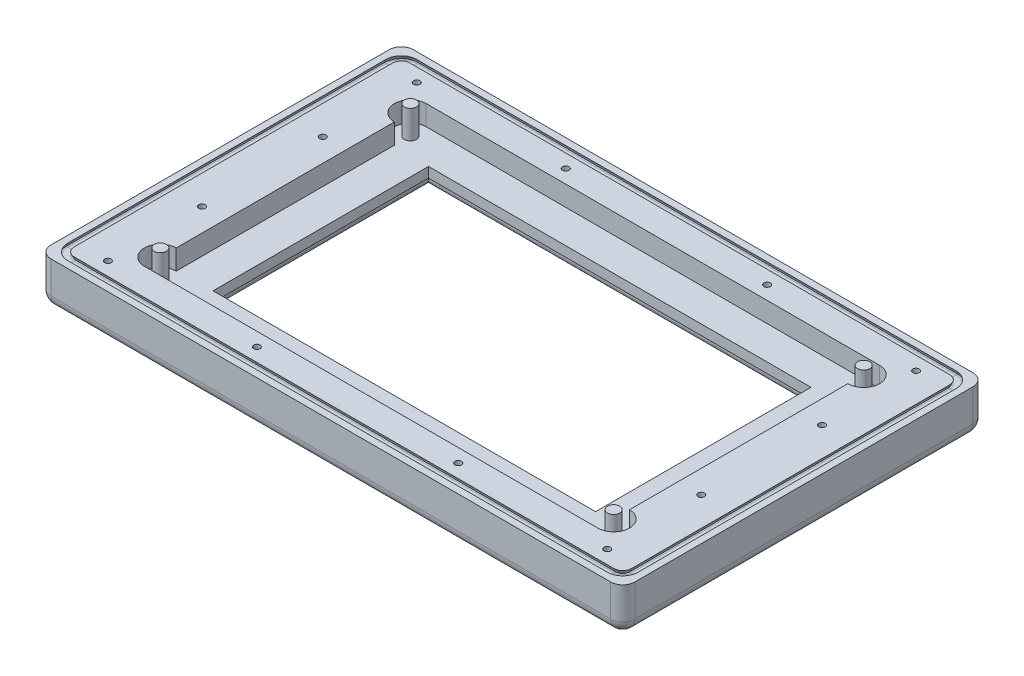
from build123d import *

# Parameters (mm, degrees)
SKETCH1_W                      = 145
SKETCH1_H                      = 90
BOSS_EXTRUDE1_DEPTH            = 6
SKETCH3_W                      = 145
SKETCH3_H                      = 90
SKETCH3_W_2                    = 135
SKETCH3_H_2                    = 80
BOSS_EXTRUDE2_DEPTH            = 5
SKETCH4_W                      = 47.5
SKETCH4_H                      = 26.75
ACRYLIC_CUTOUT_3MM_DEPTH       = 172.014619258
ACRYLIC_LIP_DEPTH              = 3.5
PEGS_DEPTH                     = 7
BOSS_EXTRUDE4_DEPTH            = 5
FILLET1_R                      = 3
FILLET2_R                      = 1
FILLET3_R                      = 3
FILLET4_R                      = 3
FILLET5_R                      = 3
FILLET6_R                      = 3
M2X0_4_TAPPED_HOLE2_AT_2_COUNT = 2
M2X0_4_TAPPED_HOLE2_AT_2_PITCH = 23.35
M2X0_4_TAPPED_HOLE2_AT_3_COUNT = 2
M2X0_4_TAPPED_HOLE2_AT_3_PITCH = 43.751828533


with BuildPart() as part:
    # Sketch1 → Boss-Extrude1 (new body)
    with BuildSketch(Plane(origin=(0, 0, 0), x_dir=(1, 0, 0), z_dir=(0, 1, 0))):
        with Locations((72.5, 45)):
            Rectangle(SKETCH1_W, SKETCH1_H)
    extrude(amount=BOSS_EXTRUDE1_DEPTH)

    # Sketch3 → Boss-Extrude2 (add)
    with BuildSketch(Plane(origin=(0, 6, 0), x_dir=(1, 0, 0), z_dir=(0, 1, 0))):
        with Locations((72.5, 45)):
            Rectangle(SKETCH3_W, SKETCH3_H)
        with Locations((72.5, 45)):
            Rectangle(SKETCH3_W_2, SKETCH3_H_2, mode=Mode.SUBTRACT)
    extrude(amount=BOSS_EXTRUDE2_DEPTH)

    # Sketch4 → Acrylic Cutout_3mm (cut, through all)
    with BuildSketch(Plane.XZ):
        with Locations((48.75, -31.625)):
            Rectangle(SKETCH4_W, SKETCH4_H)
        with Locations((48.75, -58.375)):
            Rectangle(SKETCH4_W, SKETCH4_H)
        with Locations((96.25, -58.375)):
            Rectangle(SKETCH4_W, SKETCH4_H)
        with Locations((96.25, -31.625)):
            Rectangle(SKETCH4_W, SKETCH4_H)
    extrude(amount=-ACRYLIC_CUTOUT_3MM_DEPTH, mode=Mode.SUBTRACT)

    # Sketch4<4> → Acrylic Lip (cut)
    with BuildSketch(Plane.XZ):
        Polygon((72.5, -18.25), (72.5, -16.25), (23, -16.25), (23, -45), (25, -45), (25, -18.25), align=None)
        Polygon((25, -45), (23, -45), (23, -73.75), (72.5, -73.75), (72.5, -71.75), (25, -71.75), align=None)
        Polygon((122, -73.75), (122, -45), (120, -45), (120, -71.75), (72.5, -71.75), (72.5, -73.75), align=None)
        Polygon((122, -16.25), (72.5, -16.25), (72.5, -18.25), (120, -18.25), (120, -45), (122, -45), align=None)
    extrude(amount=-ACRYLIC_LIP_DEPTH, mode=Mode.SUBTRACT)

    # Sketch5 → Pegs (add)
    with BuildSketch(Plane(origin=(0, 6, 0), x_dir=(1, 0, 0), z_dir=(0, 1, 0))):
        with BuildLine():
            ThreePointArc((16.2, 74.55), (17.260660172, 74.989339828), (17.7, 76.05))
            Line((17.7, 76.05), (16.2, 76.05))
            Line((16.2, 76.05), (16.2, 74.55))
        make_face()
        with BuildLine():
            Line((16.2, 76.05), (17.7, 76.05))
            ThreePointArc((17.7, 76.05), (15.139339828, 77.110660172), (16.2, 74.55))
            Line((16.2, 74.55), (16.2, 76.05))
        make_face()
        with BuildLine():
            ThreePointArc((17.7, 13.95), (17.260660172, 15.010660172), (16.2, 15.45))
            Line((16.2, 15.45), (16.2, 13.95))
            Line((16.2, 13.95), (17.7, 13.95))
        make_face()
        with BuildLine():
            Line((16.2, 13.95), (16.2, 15.45))
            ThreePointArc((16.2, 15.45), (15.139339828, 12.889339828), (17.7, 13.95))
            Line((17.7, 13.95), (16.2, 13.95))
        make_face()
        with BuildLine():
            ThreePointArc((130.3, 13.95), (129.860660172, 15.010660172), (128.8, 15.45))
            Line((128.8, 15.45), (128.8, 13.95))
            Line((128.8, 13.95), (127.3, 13.95))
            ThreePointArc((127.3, 13.95), (128.8, 12.45), (130.3, 13.95))
        make_face()
        with BuildLine():
            Line((128.8, 13.95), (128.8, 15.45))
            ThreePointArc((128.8, 15.45), (127.739339828, 15.010660172), (127.3, 13.95))
            Line((127.3, 13.95), (128.8, 13.95))
        make_face()
        with BuildLine():
            ThreePointArc((130.3, 76.05), (128.8, 77.55), (127.3, 76.05))
            Line((127.3, 76.05), (128.8, 76.05))
            Line((128.8, 76.05), (128.8, 74.55))
            ThreePointArc((128.8, 74.55), (129.860660172, 74.989339828), (130.3, 76.05))
        make_face()
        with BuildLine():
            Line((128.8, 76.05), (127.3, 76.05))
            ThreePointArc((127.3, 76.05), (127.739339828, 74.989339828), (128.8, 74.55))
            Line((128.8, 74.55), (128.8, 76.05))
        make_face()
    extrude(amount=PEGS_DEPTH)

    # Sketch5<4> → Boss-Extrude4 (add)
    with BuildSketch(Plane(origin=(0, 6, 0), x_dir=(1, 0, 0), z_dir=(0, 1, 0))):
        with BuildLine():
            Line((72.5, 80), (72.5, 85))
            Line((72.5, 85), (5, 85))
            Line((5, 85), (5, 45))
            Line((5, 45), (16.2, 45))
            Line((16.2, 45), (16.2, 72.1))
            ThreePointArc((16.2, 72.1), (12.25, 76.05), (16.2, 80))
            Line((16.2, 80), (72.5, 80))
        make_face()
        with BuildLine():
            Line((16.2, 45), (5, 45))
            Line((5, 45), (5, 5))
            Line((5, 5), (72.5, 5))
            Line((72.5, 5), (72.5, 10))
            Line((72.5, 10), (16.2, 10))
            ThreePointArc((16.2, 10), (12.25, 13.95), (16.2, 17.9))
            Line((16.2, 17.9), (16.2, 45))
        make_face()
        with BuildLine():
            Line((140, 5), (140, 45))
            Line((140, 45), (128.8, 45))
            Line((128.8, 45), (128.8, 17.9))
            ThreePointArc((128.8, 17.9), (131.593071786, 16.743071786), (132.75, 13.95))
            ThreePointArc((132.75, 13.95), (131.593071786, 11.156928214), (128.8, 10))
            Line((128.8, 10), (72.5, 10))
            Line((72.5, 10), (72.5, 5))
            Line((72.5, 5), (140, 5))
        make_face()
        with BuildLine():
            Line((140, 85), (72.5, 85))
            Line((72.5, 85), (72.5, 80))
            Line((72.5, 80), (128.8, 80))
            ThreePointArc((128.8, 80), (131.593071786, 78.843071786), (132.75, 76.05))
            ThreePointArc((132.75, 76.05), (131.593071786, 73.256928214), (128.8, 72.1))
            Line((128.8, 72.1), (128.8, 45))
            Line((128.8, 45), (140, 45))
            Line((140, 45), (140, 85))
        make_face()
    extrude(amount=BOSS_EXTRUDE4_DEPTH)

    # Fillet1
    fillet1_edges = [part.edges().sort_by_distance(p)[0] for p in [
        (72.5, 0, -90),
        (145, 0, -45),
        (72.5, 0, 0),
        (0, 0, -45),
    ]]
    fillet(fillet1_edges, radius=FILLET1_R)

    # Fillet2
    fillet2_edges = [part.edges().sort_by_distance(p)[0] for p in [
        (23, 0, -45),
        (72.5, 0, -16.25),
        (72.5, 0, -73.75),
        (122, 0, -45),
    ]]
    fillet(fillet2_edges, radius=FILLET2_R)

    # Fillet3
    # the kernel refuses this fillet: 3 mm, written as the material it takes off along each edge
    with BuildSketch(Plane(origin=(3, 3, -87), x_dir=(-1, 0, 0), z_dir=(0, 0, -1))) as fillet3_piece_1_section:
        Polygon((0, 0), (FILLET3_R, 0), (FILLET3_R, -FILLET3_R), (0, -FILLET3_R), align=None)
    fillet3_piece_1 = extrude(amount=FILLET3_R, mode=Mode.PRIVATE)
    fillet3_piece_1 = fillet3_piece_1 - Plane(origin=(3, 3, -87), x_dir=(0.7071067811865475, 0.7071067811865475, 0), z_dir=(0, 0, -1)) * Sphere(FILLET3_R, mode=Mode.PRIVATE)
    add(fillet3_piece_1, mode=Mode.SUBTRACT)
    with BuildSketch(Plane(origin=(0, 18.5, -90), x_dir=(1, 0, 0), z_dir=(0, -1, 0))) as fillet3_piece_2:
        with BuildLine():
            CenterArc((FILLET3_R, FILLET3_R), FILLET3_R, 180, 90)
            Line((0, FILLET3_R), (0, 0))
            Line((0, 0), (FILLET3_R, 0))
        make_face()
    extrude(amount=15.5, mode=Mode.SUBTRACT)

    # Fillet4
    # the kernel refuses this fillet: 3 mm, written as the material it takes off along each edge
    with BuildSketch(Plane(origin=(142, 3, -87), x_dir=(1, 0, 0), z_dir=(0, 0, -1))) as fillet4_piece_1_section:
        Polygon((0, 0), (FILLET4_R, 0), (FILLET4_R, FILLET4_R), (0, FILLET4_R), align=None)
    fillet4_piece_1 = extrude(amount=FILLET4_R, mode=Mode.PRIVATE)
    fillet4_piece_1 = fillet4_piece_1 - Plane(origin=(142, 3, -87), x_dir=(-0.7071067811865475, 0.7071067811865475, 0), z_dir=(0, 0, -1)) * Sphere(FILLET4_R, mode=Mode.PRIVATE)
    add(fillet4_piece_1, mode=Mode.SUBTRACT)
    with BuildSketch(Plane(origin=(145, 3, -90), x_dir=(-1, 0, 0), z_dir=(0, 1, 0))) as fillet4_piece_2:
        with BuildLine():
            CenterArc((FILLET4_R, FILLET4_R), FILLET4_R, 180, 90)
            Line((0, FILLET4_R), (0, 0))
            Line((0, 0), (FILLET4_R, 0))
        make_face()
    extrude(amount=15.5, mode=Mode.SUBTRACT)

    # Fillet5
    # the kernel refuses this fillet: 3 mm, written as the material it takes off along each edge
    with BuildSketch(Plane(origin=(142, 3, -3), x_dir=(0, 0, 1), z_dir=(1, 0, 0))) as fillet5_piece_1_section:
        Polygon((0, 0), (FILLET5_R, 0), (FILLET5_R, FILLET5_R), (0, FILLET5_R), align=None)
    fillet5_piece_1 = extrude(amount=FILLET5_R, mode=Mode.PRIVATE)
    fillet5_piece_1 = fillet5_piece_1 - Plane(origin=(142, 3, -3), x_dir=(0, 0.7071067811865475, -0.7071067811865475), z_dir=(1, 0, 0)) * Sphere(FILLET5_R, mode=Mode.PRIVATE)
    add(fillet5_piece_1, mode=Mode.SUBTRACT)
    with BuildSketch(Plane(origin=(145, 3, 0), x_dir=(0, 0, -1), z_dir=(0, 1, 0))) as fillet5_piece_2:
        with BuildLine():
            CenterArc((FILLET5_R, FILLET5_R), FILLET5_R, 180, 90)
            Line((0, FILLET5_R), (0, 0))
            Line((0, 0), (FILLET5_R, 0))
        make_face()
    extrude(amount=15.5, mode=Mode.SUBTRACT)

    # Fillet6
    # the kernel refuses this fillet: 3 mm, written as the material it takes off along each edge
    with BuildSketch(Plane(origin=(3, 3, -3), x_dir=(0, 0, 1), z_dir=(-1, 0, 0))) as fillet6_piece_1_section:
        Polygon((0, 0), (FILLET6_R, 0), (FILLET6_R, -FILLET6_R), (0, -FILLET6_R), align=None)
    fillet6_piece_1 = extrude(amount=FILLET6_R, mode=Mode.PRIVATE)
    fillet6_piece_1 = fillet6_piece_1 - Plane(origin=(3, 3, -3), x_dir=(0, 0.7071067811865475, -0.7071067811865475), z_dir=(-1, 0, 0)) * Sphere(FILLET6_R, mode=Mode.PRIVATE)
    add(fillet6_piece_1, mode=Mode.SUBTRACT)
    with BuildSketch(Plane(origin=(0, 18.5, 0), x_dir=(0, 0, -1), z_dir=(0, -1, 0))) as fillet6_piece_2:
        with BuildLine():
            CenterArc((FILLET6_R, FILLET6_R), FILLET6_R, 180, 90)
            Line((0, FILLET6_R), (0, 0))
            Line((0, 0), (FILLET6_R, 0))
        make_face()
    extrude(amount=15.5, mode=Mode.SUBTRACT)

    # Cut-Sweep1: sweep along a path in Sketch6
    with BuildLine(Plane(origin=(0, 11, 0), x_dir=(1, 0, 0), z_dir=(0, 1, 0))) as cut_sweep1_path:
        Line((139.5, 87.5), (5.5, 87.5))
        ThreePointArc((5.5, 87.5), (3.378679656, 86.621320344), (2.5, 84.5))
        Line((2.5, 84.5), (2.5, 5.5))
        ThreePointArc((2.5, 5.5), (3.378679656, 3.378679656), (5.5, 2.5))
        Line((5.5, 2.5), (139.5, 2.5))
        ThreePointArc((139.5, 2.5), (141.621320344, 3.378679656), (142.5, 5.5))
        Line((142.5, 5.5), (142.5, 84.5))
        ThreePointArc((142.5, 84.5), (141.621320344, 86.621320344), (139.5, 87.5))
    # Sketch7 → Cut-Sweep1 (sweep, cut)
    with BuildSketch(Plane(origin=(5.5, 0, 0), x_dir=(0, 0, -1), z_dir=(1, 0, 0))):
        Polygon((1.7, 11), (3.3, 11), (3.700705817, 10.1), (3.3, 10.1), (1.7, 10.1), (1.299294183, 10.1), align=None)
    sweep(path=cut_sweep1_path.line, mode=Mode.SUBTRACT)

    # Sketch13 → M2x0.4 Tapped Hole2 (revolve, cut)
    with BuildSketch(Plane(origin=(10.5, 11, -60), x_dir=(0, 0, 1), z_dir=(1, 0, 0))):
        Polygon((0, 0), (0, 5.480688495), (0.8, 5), (0.8, 0), align=None)
    m2x0_4_tapped_hole2 = revolve(axis=Axis((10.5, 17.35, -60), (0, -1, 0)), mode=Mode.SUBTRACT)

    # M2x0.4 Tapped Hole2 at 2: M2x0.4 Tapped Hole2 ×2
    with Locations(*[(0, 0, -i * M2X0_4_TAPPED_HOLE2_AT_2_PITCH) for i in range(1, M2X0_4_TAPPED_HOLE2_AT_2_COUNT)]):
        add(m2x0_4_tapped_hole2, mode=Mode.SUBTRACT)

    # M2x0.4 Tapped Hole2 at 3: M2x0.4 Tapped Hole2 ×2
    with Locations(*[Vector(0.845678940524949, 0, -0.5336919800339892) * (i * M2X0_4_TAPPED_HOLE2_AT_3_PITCH) for i in range(1, M2X0_4_TAPPED_HOLE2_AT_3_COUNT)]):
        add(m2x0_4_tapped_hole2, mode=Mode.SUBTRACT)

    # Mirror1: M2x0.4 Tapped Hole2 across plane
    add(m2x0_4_tapped_hole2.mirror(Plane.XY.offset(-45)), mode=Mode.SUBTRACT)

    # Mirror1 copy 1 sketch → Mirror1 copy 1 (revolve, cut)
    with BuildSketch(Plane(origin=(10.5, 11, -6.65), x_dir=(0, 0, -1), z_dir=(1, 0, 0))):
        Polygon((0, 0), (0, -5.480688495), (0.8, -5), (0.8, 0), align=None)
    revolve(axis=Axis((10.5, 17.35, -6.65), (0, 1, 0)), mode=Mode.SUBTRACT)

    # Mirror1 copy 2 sketch → Mirror1 copy 2 (revolve, cut)
    with BuildSketch(Plane(origin=(47.5, 11, -6.65), x_dir=(0, 0, -1), z_dir=(1, 0, 0))):
        Polygon((0, 0), (0, -5.480688495), (0.8, -5), (0.8, 0), align=None)
    revolve(axis=Axis((47.5, 17.35, -6.65), (0, 1, 0)), mode=Mode.SUBTRACT)

    # Mirror3: M2x0.4 Tapped Hole2 across plane
    add(m2x0_4_tapped_hole2.mirror(Plane(origin=(72.5, 0, 0), x_dir=(0, 0, 1), z_dir=(1, 0, 0))), mode=Mode.SUBTRACT)

    # Mirror3 copy 1 sketch → Mirror3 copy 1 (revolve, cut)
    with BuildSketch(Plane(origin=(134.5, 11, -83.35), x_dir=(0, 0, 1), z_dir=(-1, 0, 0))):
        Polygon((0, 0), (0, -5.480688495), (0.8, -5), (0.8, 0), align=None)
    revolve(axis=Axis((134.5, 17.35, -83.35), (0, 1, 0)), mode=Mode.SUBTRACT)

    # Mirror3 copy 2 sketch → Mirror3 copy 2 (revolve, cut)
    with BuildSketch(Plane(origin=(97.5, 11, -83.35), x_dir=(0, 0, 1), z_dir=(-1, 0, 0))):
        Polygon((0, 0), (0, -5.480688495), (0.8, -5), (0.8, 0), align=None)
    revolve(axis=Axis((97.5, 17.35, -83.35), (0, 1, 0)), mode=Mode.SUBTRACT)

    # Mirror3 copy 3 sketch → Mirror3 copy 3 (revolve, cut)
    with BuildSketch(Plane(origin=(134.5, 11, -30), x_dir=(0, 0, -1), z_dir=(-1, 0, 0))):
        Polygon((0, 0), (0, 5.480688495), (0.8, 5), (0.8, 0), align=None)
    revolve(axis=Axis((134.5, 17.35, -30), (0, -1, 0)), mode=Mode.SUBTRACT)

    # Mirror3 copy 4 sketch → Mirror3 copy 4 (revolve, cut)
    with BuildSketch(Plane(origin=(134.5, 11, -6.65), x_dir=(0, 0, -1), z_dir=(-1, 0, 0))):
        Polygon((0, 0), (0, 5.480688495), (0.8, 5), (0.8, 0), align=None)
    revolve(axis=Axis((134.5, 17.35, -6.65), (0, -1, 0)), mode=Mode.SUBTRACT)

    # Mirror3 copy 5 sketch → Mirror3 copy 5 (revolve, cut)
    with BuildSketch(Plane(origin=(97.5, 11, -6.65), x_dir=(0, 0, -1), z_dir=(-1, 0, 0))):
        Polygon((0, 0), (0, 5.480688495), (0.8, 5), (0.8, 0), align=None)
    revolve(axis=Axis((97.5, 17.35, -6.65), (0, -1, 0)), mode=Mode.SUBTRACT)


solid = part.part
